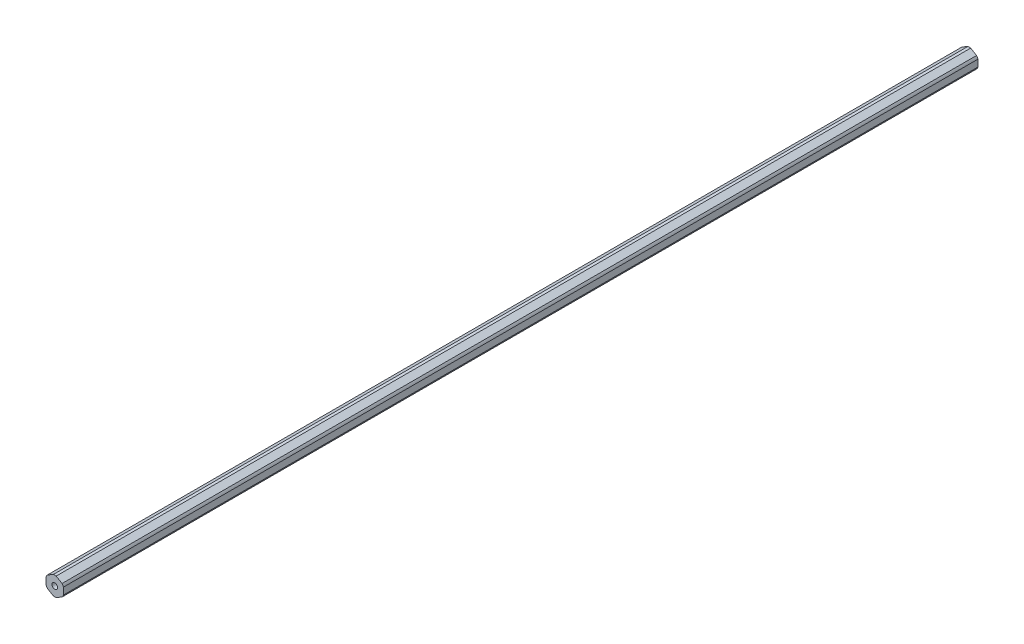
from build123d import *

# Parameters (mm, degrees)
BOSS_EXTRUDE1_DEPTH        = 663.575
F_10_32_TAPPED_HOLE1_D     = 4.0386
F_10_32_TAPPED_HOLE1_DEPTH = 12.02944
F_10_32_TAPPED_HOLE1_TIP   = 1.213317848
F_10_32_TAPPED_HOLE2_D     = 4.0386
F_10_32_TAPPED_HOLE2_DEPTH = 12.02944
F_10_32_TAPPED_HOLE2_TIP   = 1.213317848


with BuildPart() as part:
    # Sketch1 → Boss-Extrude1 (new body)
    with BuildSketch(Plane.XY):
        with BuildLine():
            ThreePointArc((6.35, 2.48767683), (5.906206651, 3.40995), (5.329391331, 4.255422899))
            Line((5.329391331, 4.255422899), (1.020608669, 6.743099729))
            ThreePointArc((1.020608669, 6.743099729), (0, 6.8199), (-1.020608669, 6.743099729))
            Line((-1.020608669, 6.743099729), (-5.329391331, 4.255422899))
            ThreePointArc((-5.329391331, 4.255422899), (-5.906206651, 3.40995), (-6.35, 2.48767683))
            Line((-6.35, 2.48767683), (-6.35, -2.48767683))
            ThreePointArc((-6.35, -2.48767683), (-5.906206651, -3.40995), (-5.329391331, -4.255422899))
            Line((-5.329391331, -4.255422899), (-1.020608669, -6.743099729))
            ThreePointArc((-1.020608669, -6.743099729), (0, -6.8199), (1.020608669, -6.743099729))
            Line((1.020608669, -6.743099729), (5.329391331, -4.255422899))
            ThreePointArc((5.329391331, -4.255422899), (5.906206651, -3.40995), (6.35, -2.48767683))
            Line((6.35, -2.48767683), (6.35, 2.48767683))
        make_face()
    extrude(amount=BOSS_EXTRUDE1_DEPTH)

    # #10-32 Tapped Hole1
    with Locations(Plane.XY.offset(663.575)):
        with Locations((0, 0)):
            Hole(F_10_32_TAPPED_HOLE1_D / 2, depth=F_10_32_TAPPED_HOLE1_DEPTH)
            with Locations((0, 0, -(F_10_32_TAPPED_HOLE1_DEPTH + F_10_32_TAPPED_HOLE1_TIP / 2))):  # 118° drill point
                Cone(0, F_10_32_TAPPED_HOLE1_D / 2, F_10_32_TAPPED_HOLE1_TIP, mode=Mode.SUBTRACT)

    # #10-32 Tapped Hole2
    with Locations(Plane(origin=(0, 0, 0), x_dir=(-1, 0, 0), z_dir=(0, 0, -1))):
        with Locations((0, 0)):
            Hole(F_10_32_TAPPED_HOLE2_D / 2, depth=F_10_32_TAPPED_HOLE2_DEPTH)
            with Locations((0, 0, -(F_10_32_TAPPED_HOLE2_DEPTH + F_10_32_TAPPED_HOLE2_TIP / 2))):  # 118° drill point
                Cone(0, F_10_32_TAPPED_HOLE2_D / 2, F_10_32_TAPPED_HOLE2_TIP, mode=Mode.SUBTRACT)


solid = part.part
